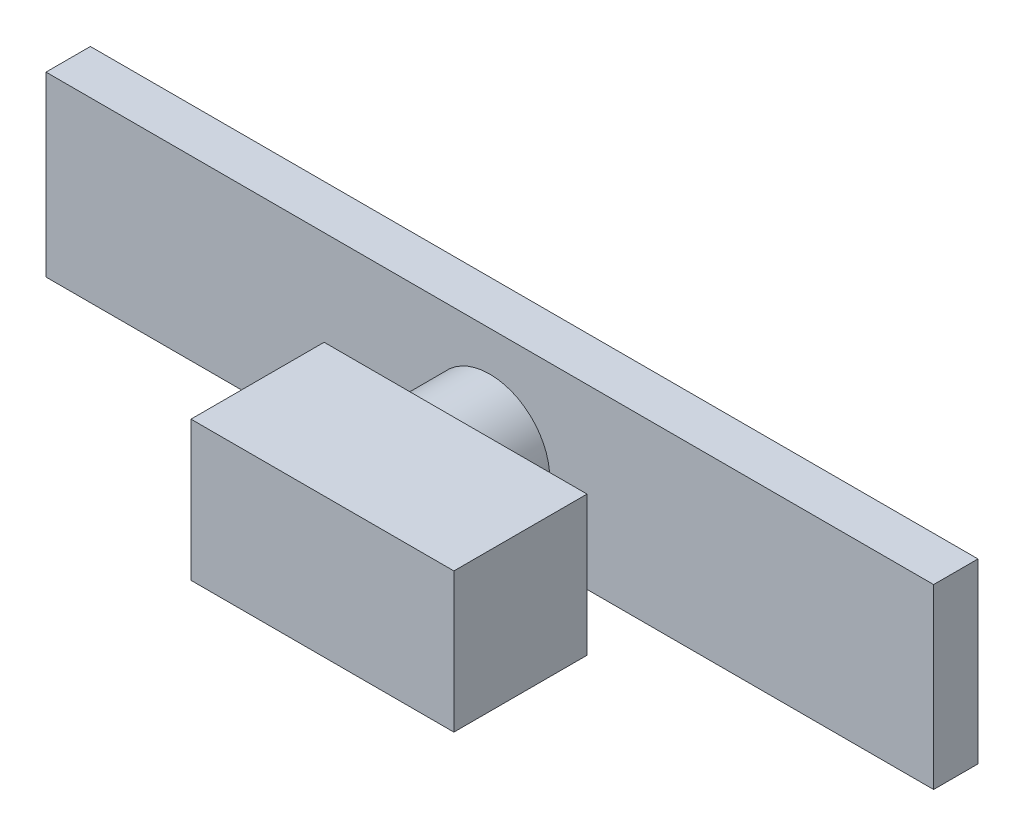
from build123d import *

# Parameters (mm, degrees)
SKETCH2_W           = 254
SKETCH2_H           = 12.7
BOSS_EXTRUDE1_DEPTH = 50.8
SKETCH3_R           = 17.140791438
BOSS_EXTRUDE2_DEPTH = 19.05
SKETCH4_W           = 75.235944222
SKETCH4_H           = 39.955088207
BOSS_EXTRUDE3_DEPTH = 38.1
SCALE2_SCALE        = 0.06
ROTATE_ANGLE        = 90
SCALE5_SCALE        = 0.25
SCALE6_SCALE        = 0.25


with BuildPart() as part:
    # Sketch2 → Boss-Extrude1 (new body)
    with BuildSketch(Plane.XY):
        with Locations((79.130769231, 14.898076923)):
            Rectangle(SKETCH2_W, SKETCH2_H)
    extrude(amount=BOSS_EXTRUDE1_DEPTH)

    # Sketch3 → Boss-Extrude2 (add)
    with BuildSketch(Plane(origin=(0, 21.248076923, 0), x_dir=(1, 0, 0), z_dir=(0, 1, 0))):
        with Locations((79.130769231, -28.483063876)):
            Circle(SKETCH3_R)
    extrude(amount=BOSS_EXTRUDE2_DEPTH)

    # Sketch4 → Boss-Extrude3 (add)
    with BuildSketch(Plane(origin=(0, 40.298076923, 0), x_dir=(1, 0, 0), z_dir=(0, 1, 0))):
        with Locations((88.38546847, -28.088530296)):
            Rectangle(SKETCH4_W, SKETCH4_H)
    extrude(amount=BOSS_EXTRUDE3_DEPTH)


with BuildPart() as part_1:
    # Scale2: scaled about (82.711857342, 33.041003565, 26.623476887)
    add(part.part.scale(SCALE2_SCALE).moved(Location((77.749145901, 31.058543351, 25.026068274))))


with BuildPart() as part_2:
    # rotate: moved
    add(part_1.part.rotate(Axis((0, 33.666927966, 26.550068274), (1, 0, 0)), ROTATE_ANGLE))


with BuildPart() as part_3:
    # Scale5: scaled about (82.711857342, 33.593519353, 25.924143873)
    add(part_2.part.scale(SCALE5_SCALE).moved(Location((62.033893007, 25.195139515, 19.443107905))))


with BuildPart() as part_4:
    # Move Body 4 x: moved
    add(part_3.part.moved(Location((-101.6, 0, 0))))


with BuildPart() as part_5:
    # Move Body 2 y: moved
    add(part_4.part.moved(Location((0, -50.8, 0))))


with BuildPart() as part_6:
    # Scale6: scaled about (-18.888142658, -17.206480647, 25.924143873)
    add(part_5.part.scale(SCALE6_SCALE).moved(Location((-14.166106993, -12.904860485, 19.443107905))))


solid = part_6.part
